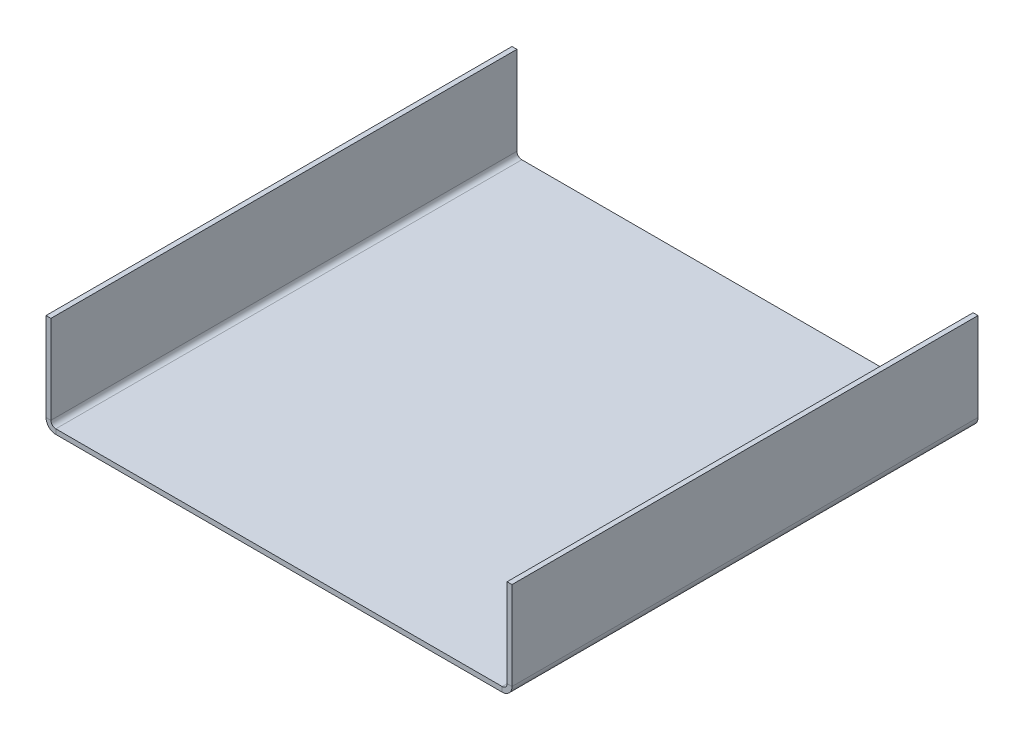
from build123d import *

# Parameters (mm, degrees)
SKETCH1_W                      = 95
SKETCH1_H                      = 95
BOSS_EXTRUDE1_DEPTH            = 1
EDGE_FLANGE1_STRIP_W           = 6
EDGE_FLANGE1_STRIP_H           = 1
EDGE_FLANGE1_STRIP_CUT_DEPTH   = 95
EDGE_FLANGE1_STRIP_2_W         = 6
EDGE_FLANGE1_STRIP_2_H         = 1
EDGE_FLANGE1_STRIP_CUT_2_DEPTH = 95
EDGE_FLANGE1_DEPTH             = 95
EDGE_FLANGE1_BEND_DEPTH        = 95


# Sheet-metal steps are written as plain solids
with BuildPart() as part:
    # Sketch1 → Boss-Extrude1 (new body)
    with BuildSketch(Plane(origin=(0, 0, 0), x_dir=(1, 0, 0), z_dir=(0, 1, 0))):
        Rectangle(SKETCH1_W, SKETCH1_H)
    extrude(amount=BOSS_EXTRUDE1_DEPTH)

    # Edge-Flange1 strip (across the edge) → Edge-Flange1 strip cut (cut)
    with BuildSketch(Plane(origin=(-47.5, 1, -47.5), x_dir=(1, 0, 0), z_dir=(0, 0, 1))):
        with Locations((-1, -0.5)):
            Rectangle(EDGE_FLANGE1_STRIP_W, EDGE_FLANGE1_STRIP_H)
    extrude(amount=EDGE_FLANGE1_STRIP_CUT_DEPTH, mode=Mode.SUBTRACT)

    # Edge-Flange1 strip 2 (across the edge) → Edge-Flange1 strip cut 2 (cut)
    with BuildSketch(Plane(origin=(47.5, 1, 47.5), x_dir=(-1, 0, 0), z_dir=(0, 0, -1))):
        with Locations((-1, -0.5)):
            Rectangle(EDGE_FLANGE1_STRIP_2_W, EDGE_FLANGE1_STRIP_2_H)
    extrude(amount=EDGE_FLANGE1_STRIP_CUT_2_DEPTH, mode=Mode.SUBTRACT)

    # Edge-Flange1 section (across the edge) → Edge-Flange1 (add)
    with BuildSketch(Plane(origin=(-47.5, 1, -47.5), x_dir=(1, 0, 0), z_dir=(0, 0, 1))):
        with BuildLine():
            Line((0, 1), (0, 19))
            Line((0, 19), (1, 19))
            Line((1, 19), (1, 1))
            ThreePointArc((1, 1), (1.292893219, 0.292893219), (2, 0))
            Line((2, 0), (2, -1))
            ThreePointArc((2, -1), (0.585786438, -0.414213562), (0, 1))
        make_face()
    extrude(amount=EDGE_FLANGE1_DEPTH)

    # Edge-Flange1 section 2 (across the edge) → Edge-Flange1 bend (add)
    with BuildSketch(Plane(origin=(47.5, 1, 47.5), x_dir=(-1, 0, 0), z_dir=(0, 0, -1))):
        with BuildLine():
            Line((0, 1), (0, 19))
            Line((0, 19), (1, 19))
            Line((1, 19), (1, 1))
            ThreePointArc((1, 1), (1.292893219, 0.292893219), (2, 0))
            Line((2, 0), (2, -1))
            ThreePointArc((2, -1), (0.585786438, -0.414213562), (0, 1))
        make_face()
    extrude(amount=EDGE_FLANGE1_BEND_DEPTH)


solid = part.part
